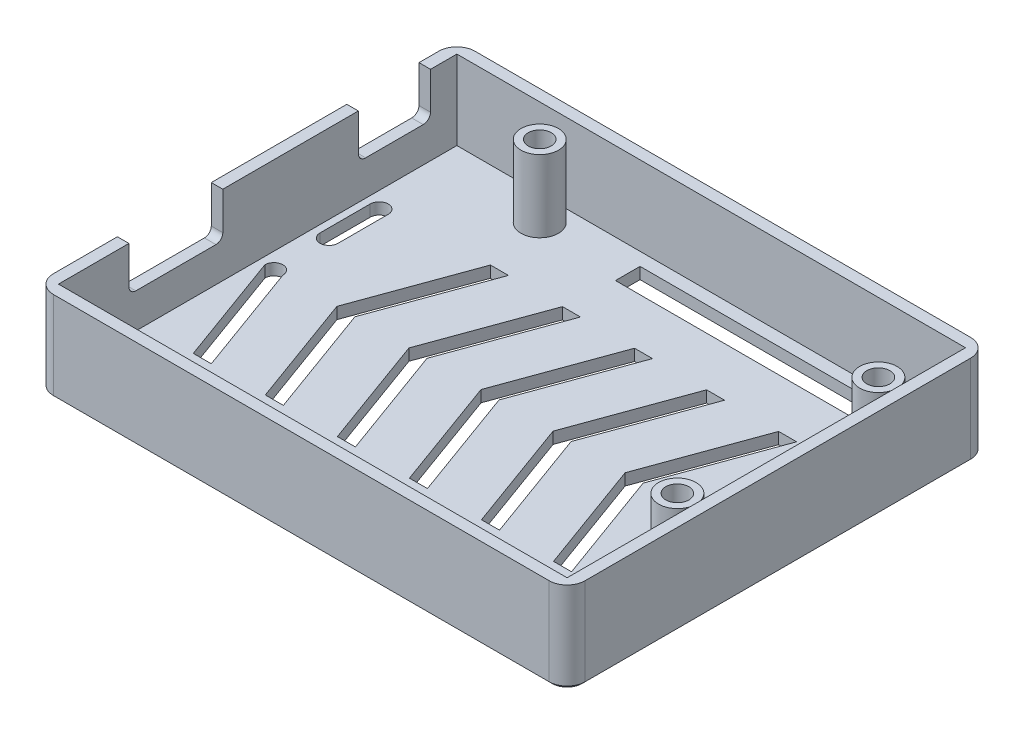
from build123d import *

# Parameters (mm, degrees)
SKETCH2_W           = 70.6
SKETCH2_H           = 55.3
BOSS_EXTRUDE1_DEPTH = 11
SHELL1_T            = 1.6
FILLET1_R           = 2.5
SKETCH2_4_R         = 2.6
SKETCH2_4_R_2       = 1.6
BOSS_EXTRUDE2_DEPTH = 10
CUT_EXTRUDE1_DEPTH  = 3
CUT_EXTRUDE2_DEPTH  = 3
SKETCH8_W           = 48.24
SKETCH8_H           = 3.41
SKETCH8_W_2         = 39.1
CUT_EXTRUDE3_DEPTH  = 1.8
CUT_EXTRUDE4_DEPTH  = 3.5
CHAMFER1_SIZE       = 0.45


with BuildPart() as part:
    # Sketch2 → Boss-Extrude1 (new body)
    with BuildSketch(Plane(origin=(0, 0, 0), x_dir=(1, 0, 0), z_dir=(0, 1, 0))):
        with Locations((34.3, 26.65)):
            Rectangle(SKETCH2_W, SKETCH2_H)
    extrude(amount=BOSS_EXTRUDE1_DEPTH)

    # Shell1
    shell1_openings = [part.faces().sort_by_distance(p)[0] for p in [
        (34.3, 11, -26.65),
    ]]
    offset(amount=SHELL1_T, openings=shell1_openings, kind=Kind.INTERSECTION)

    # Fillet1
    # the kernel refuses this fillet: 2.5 mm, written as the material it takes off along each edge
    with BuildSketch(Plane(origin=(-2.6, 17.25, 2.6), x_dir=(1, 0, 0), z_dir=(0, -1, 0)), Plane(origin=(71.2, 17.25, 2.6), x_dir=(0, 0, -1), z_dir=(0, -1, 0)), Plane(origin=(71.2, 17.25, -55.9), x_dir=(-1, 0, 0), z_dir=(0, -1, 0)), Plane(origin=(-2.6, -7.85, -55.9), x_dir=(1, 0, 0), z_dir=(0, 1, 0))) as fillet1_piece_1:
        with BuildLine():
            CenterArc((FILLET1_R, -FILLET1_R), FILLET1_R, 90, 90)
            Line((0, -FILLET1_R), (0, 0))
            Line((0, 0), (FILLET1_R, 0))
        make_face()
    extrude(amount=25.1, mode=Mode.SUBTRACT)

    # Sketch2<4> → Boss-Extrude2 (add)
    # profile 1 of 3: a face of its own
    with BuildSketch(Plane(origin=(0, 0, 0), x_dir=(1, 0, 0), z_dir=(0, 1, 0))):
        with Locations(Location((66.1, 17.8, 0), (0, 0, 90))):
            Circle(SKETCH2_4_R)
        with Locations(Location((66.1, 17.8, 0), (0, 0, 270))):
            Circle(SKETCH2_4_R_2, mode=Mode.SUBTRACT)
    # profile 2 of 3: a face of its own
    with BuildSketch(Plane(origin=(0, 0, 0), x_dir=(1, 0, 0), z_dir=(0, 1, 0))):
        with Locations(Location((14, 50.8, 0), (0, 0, 90))):
            Circle(SKETCH2_4_R)
        with Locations(Location((14, 50.8, 0), (0, 0, 270))):
            Circle(SKETCH2_4_R_2, mode=Mode.SUBTRACT)
    # profile 3 of 3: a face of its own
    with BuildSketch(Plane(origin=(0, 0, 0), x_dir=(1, 0, 0), z_dir=(0, 1, 0))):
        with Locations(Location((66.1, 45.7, 0), (0, 0, 90))):
            Circle(SKETCH2_4_R)
        with Locations(Location((66.1, 45.7, 0), (0, 0, 270))):
            Circle(SKETCH2_4_R_2, mode=Mode.SUBTRACT)
    extrude(amount=BOSS_EXTRUDE2_DEPTH)

    # Sketch4 → Cut-Extrude1 (cut)
    with BuildSketch(Plane.ZY.offset(2.6)):
        with BuildLine():
            Line((-21.810563814, 11), (-21.810563814, 5.78))
            ThreePointArc((-21.810563814, 5.78), (-21.530873699, 5.10266948), (-20.854775908, 4.820012494))
            Line((-20.854775908, 4.820012494), (-9.735787906, 4.820012494))
            ThreePointArc((-9.735787906, 4.820012494), (-9.058457386, 5.101442143), (-8.78, 5.78))
            Line((-8.78, 5.78), (-8.78, 11))
            Line((-8.78, 11), (-21.810563814, 11))
        make_face()
    extrude(amount=-CUT_EXTRUDE1_DEPTH, mode=Mode.SUBTRACT)

    # Sketch6 → Cut-Extrude2 (cut)
    with BuildSketch(Plane.ZY.offset(2.6)):
        with BuildLine():
            Line((-50.64, 11), (-50.64, 5.846332149))
            ThreePointArc((-50.64, 5.846332149), (-50.33827519, 5.142948487), (-49.627556174, 4.858932788))
            Line((-49.627556174, 4.858932788), (-41.634891875, 4.858932788))
            ThreePointArc((-41.634891875, 4.858932788), (-40.924172858, 5.142948487), (-40.622448048, 5.846332149))
            Line((-40.622448048, 5.846332149), (-40.622448048, 11))
            Line((-40.622448048, 11), (-50.64, 11))
        make_face()
    extrude(amount=-CUT_EXTRUDE2_DEPTH, mode=Mode.SUBTRACT)

    # Sketch8 → Cut-Extrude3 (cut)
    with BuildSketch(Plane.XZ.offset(1.6)):
        with Locations((41.21, -2.525)):
            Rectangle(SKETCH8_W, SKETCH8_H)
        with Locations((45.78, -50.785)):
            Rectangle(SKETCH8_W_2, SKETCH8_H)
    extrude(amount=-CUT_EXTRUDE3_DEPTH, mode=Mode.SUBTRACT)

    # Sketch10 → Cut-Extrude4 (cut)
    with BuildSketch(Plane(origin=(0, -1.6, 0), x_dir=(-1, 0, 0), z_dir=(0, -1, 0))):
        Polygon((-2.5, 26.65), (0, 26.65), (-5.685748819, 11.028533507), (-8.185748819, 11.028533507), align=None)
        with BuildLine():
            Line((-2.5, 26.65), (0, 26.65))
            ThreePointArc((0, 26.65), (-1.25, 27.9), (-2.5, 26.65))
        make_face()
        with BuildLine():
            Line((-2.5, 41.272108294), (-2.5, 34.309766621))
            ThreePointArc((-2.5, 34.309766621), (-1.25, 33.059766621), (0, 34.309766621))
            Line((0, 34.309766621), (0, 41.272108294))
            ThreePointArc((0, 41.272108294), (-1.25, 42.522108294), (-2.5, 41.272108294))
        make_face()
        Polygon((-15.685748819, 11.028533507), (-10, 26.65), (-12.5, 26.65), (-18.185748819, 11.028533507), align=None)
        Polygon((-12.5, 26.65), (-10, 26.65), (-15.685748819, 42.271466493), (-18.185748819, 42.271466493), align=None)
        Polygon((-25.685748819, 11.028533507), (-20, 26.65), (-22.5, 26.65), (-28.185748819, 11.028533507), align=None)
        Polygon((-22.5, 26.65), (-20, 26.65), (-25.685748819, 42.271466493), (-28.185748819, 42.271466493), align=None)
        Polygon((-35.685748819, 11.028533507), (-30, 26.65), (-32.5, 26.65), (-38.185748819, 11.028533507), align=None)
        Polygon((-32.5, 26.65), (-30, 26.65), (-35.685748819, 42.271466493), (-38.185748819, 42.271466493), align=None)
        Polygon((-45.685748819, 11.028533507), (-40, 26.65), (-42.5, 26.65), (-48.185748819, 11.028533507), align=None)
        Polygon((-42.5, 26.65), (-40, 26.65), (-45.685748819, 42.271466493), (-48.185748819, 42.271466493), align=None)
        Polygon((-55.685748819, 11.028533507), (-50, 26.65), (-52.5, 26.65), (-58.185748819, 11.028533507), align=None)
        Polygon((-52.5, 26.65), (-50, 26.65), (-55.685748819, 42.271466493), (-58.185748819, 42.271466493), align=None)
    extrude(amount=-CUT_EXTRUDE4_DEPTH, mode=Mode.SUBTRACT)

    # Chamfer1
    chamfer1_edges = [part.edges().sort_by_distance(p)[0] for p in [
        (-2.6, -1.6, -26.65),
        (34.3, -1.6, -55.9),
        (71.2, -1.6, -26.65),
        (34.3, -1.6, 2.6),
        (70.467766953, -1.6, 1.867766953),
        (70.467766953, -1.6, -55.167766953),
        (-1.867766953, -1.6, 1.867766953),
        (-1.867766953, -1.6, -55.167766953),
    ]]
    chamfer(chamfer1_edges, length=CHAMFER1_SIZE)


solid = part.part
